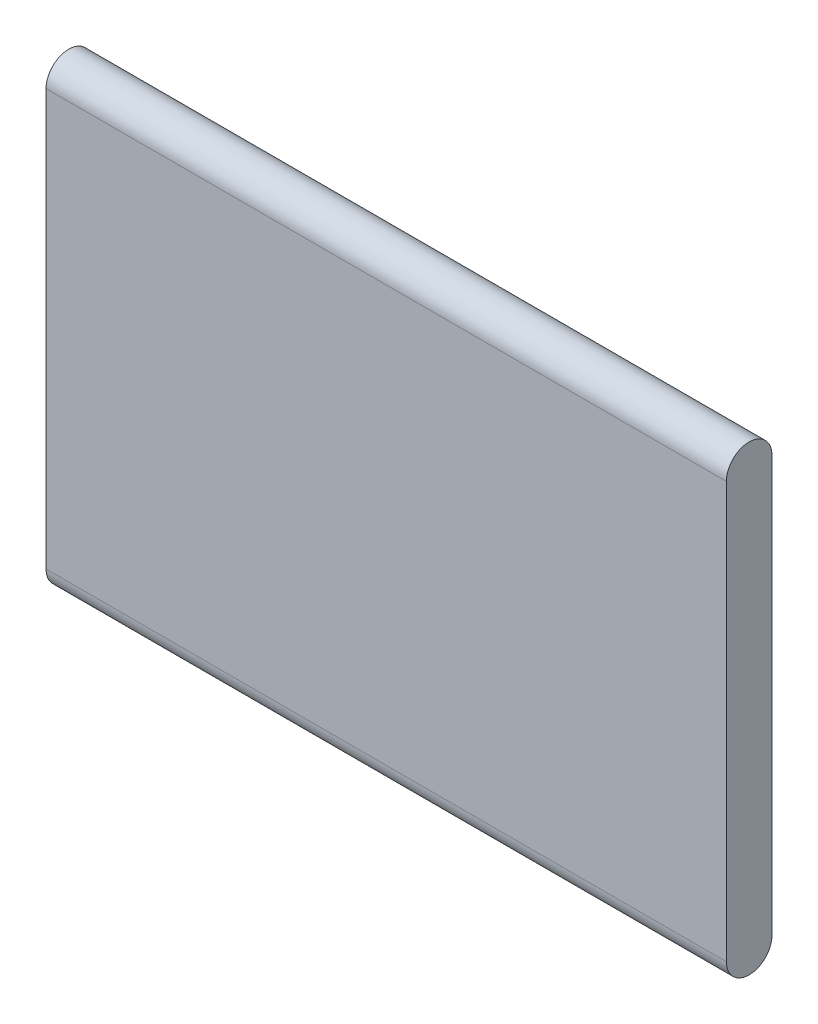
from build123d import *

# Parameters (mm, degrees)
BOSS_EXTRUDE1_DEPTH = 355.6


with BuildPart() as part:
    # Sketch1 → Boss-Extrude1 (new, symmetric)
    with BuildSketch(Plane(origin=(0, 0, 0), x_dir=(0, 0, -1), z_dir=(1, 0, 0))):
        with BuildLine():
            Line((-23.8125, 217.4875), (-23.8125, -217.4875))
            ThreePointArc((-23.8125, -217.4875), (0, -241.3), (23.8125, -217.4875))
            Line((23.8125, -217.4875), (23.8125, 217.4875))
            ThreePointArc((23.8125, 217.4875), (0, 241.3), (-23.8125, 217.4875))
        make_face()
    extrude(amount=BOSS_EXTRUDE1_DEPTH, both=True)


solid = part.part
